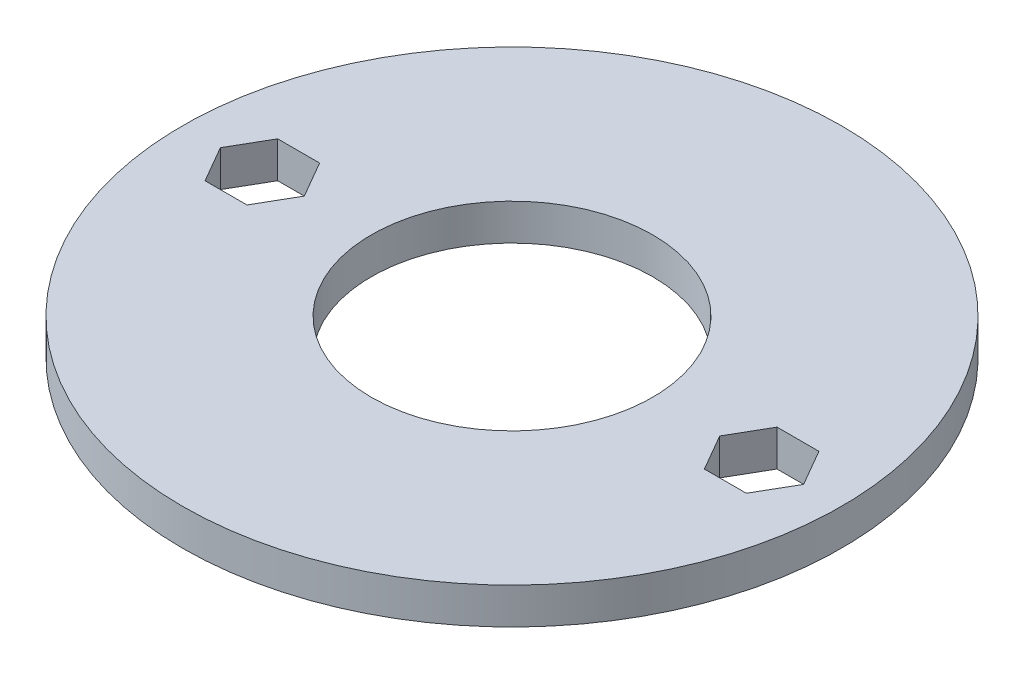
from build123d import *

# Parameters (mm, degrees)
SKETCH1_R           = 36.3
SKETCH1_R_2         = 15.5
BOSS_EXTRUDE1_DEPTH = 4


with BuildPart() as part:
    # Sketch1 → Boss-Extrude1 (new body)
    with BuildSketch(Plane(origin=(0, 0, 0), x_dir=(1, 0, 0), z_dir=(0, 1, 0))):
        Circle(SKETCH1_R)
        Circle(SKETCH1_R_2, mode=Mode.SUBTRACT)
        Polygon((25.190598923, -4), (22.881197846, 0), (25.190598923, 4), (29.809401077, 4), (32.118802154, 0), (29.809401077, -4), align=None, mode=Mode.SUBTRACT)
        Polygon((-22.881197846, 0), (-25.190598923, 4), (-29.809401077, 4), (-32.118802154, 0), (-29.809401077, -4), (-25.190598923, -4), align=None, mode=Mode.SUBTRACT)
    extrude(amount=BOSS_EXTRUDE1_DEPTH)


solid = part.part
